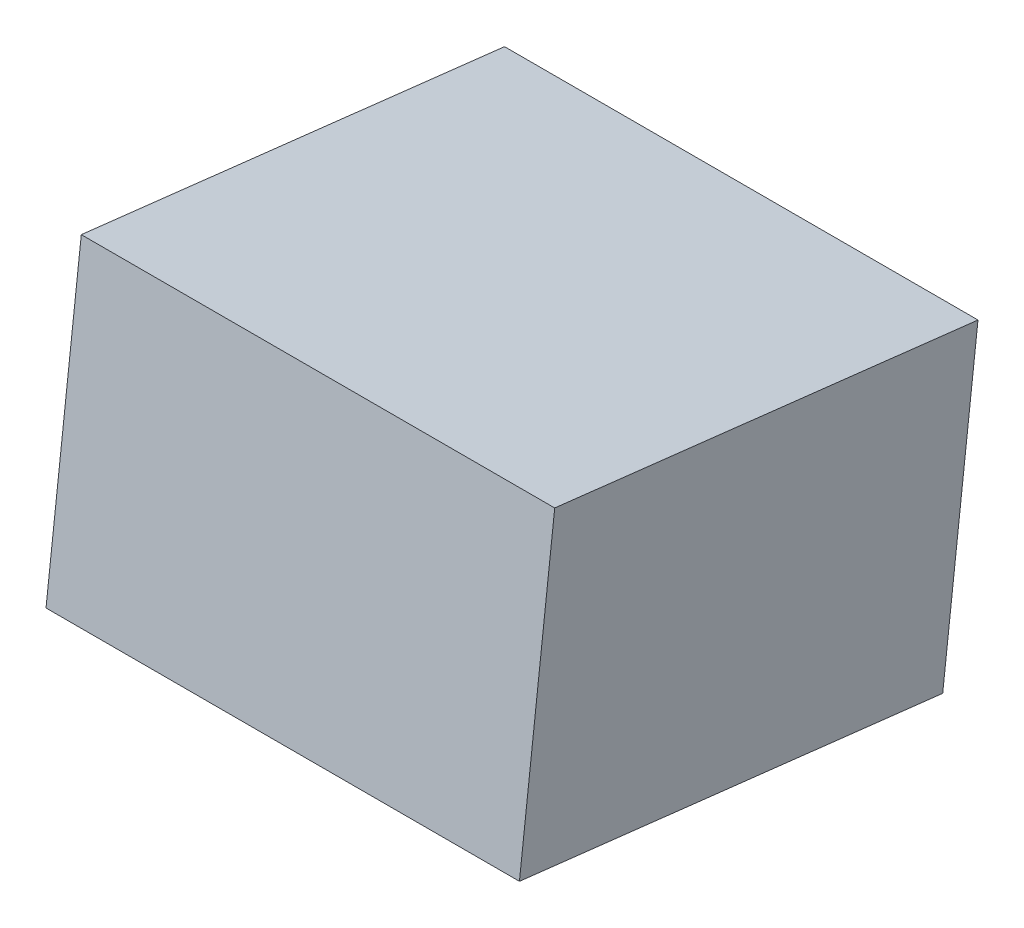
from build123d import *

# Parameters (mm, degrees)
SKETCH1_W           = 200
SKETCH1_H           = 180
BOSS_EXTRUDE1_DEPTH = 130


with BuildPart() as part:
    # Sketch1 → Boss-Extrude1 (new body)
    with BuildSketch(Plane(origin=(0, 343.978805368, -39.702551724), x_dir=(1, 0, 0), z_dir=(-6.8385480190203005e-15, 0.9934047622419532, -0.11466027365660884))):
        with Locations((-145, 150.244347434)):
            Rectangle(SKETCH1_W, SKETCH1_H)
    extrude(amount=BOSS_EXTRUDE1_DEPTH)


solid = part.part
